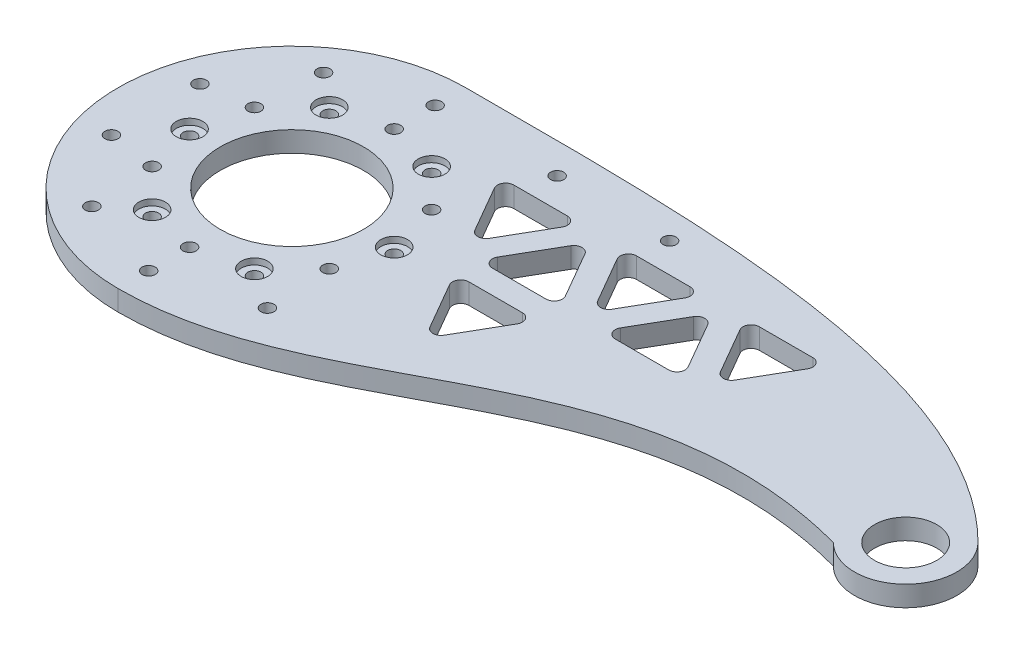
from build123d import *

# Parameters (mm, degrees)
BOSS_EXTRUDE3_OUTLINE_R   = 17.5
BOSS_EXTRUDE3_OUTLINE_R_2 = 7.6
BOSS_EXTRUDE3_DEPTH       = 5
SKETCH2_R                 = 1.6
CUT_EXTRUDE1_DEPTH        = 10
SKETCH3_R                 = 1.6
CUT_EXTRUDE2_DEPTH        = 10
SKETCH4_R                 = 1.6
CUT_EXTRUDE3_DEPTH        = 10
SKETCH5_R                 = 3.25
CUT_EXTRUDE5_DEPTH        = 1.5
CUT_EXTRUDE6_DEPTH        = 10
FILLET3_R                 = 2
FILL_PATTERN2_DEPTH       = 5
CUT_EXTRUDE7_DEPTH        = 10
FILLET4_R                 = 2
FILL_PATTERN4_DEPTH       = 5


# Read off the part's stored shape, not the designer's step: Boss-Extrude3, Fill Pattern2, Fill Pattern4
with BuildPart() as part:
    # Boss-Extrude3 outline → Boss-Extrude3 (new body)
    with BuildSketch(Plane(origin=(0, 0, 0), x_dir=(1, 0, 0), z_dir=(0, 1, 0))):
        with BuildLine():
            ThreePointArc((0, 42.5), (-42.5, 0), (0, -42.5))
            add(Edge.make_bspline(
                [(0, -42.5), (50, -42.5), (76.766110149, 8.415768242), (141.161165235, -8.838834765)],
                knots=[0, 0, 0, 0, 1, 1, 1, 1], degree=3))
            ThreePointArc((141.161165235, -8.838834765), (158.838834765, -8.838834765), (158.838834765, 8.838834765))
            add(Edge.make_bspline(
                [(0, 42.5), (53.483495706, 42.5), (123.483495706, 44.194173824), (158.838834765, 8.838834765)],
                knots=[0, 0, 0, 0, 1, 1, 1, 1], degree=3))
        make_face()
        Circle(BOSS_EXTRUDE3_OUTLINE_R, mode=Mode.SUBTRACT)
        with Locations((150, 0)):
            Circle(BOSS_EXTRUDE3_OUTLINE_R_2, mode=Mode.SUBTRACT)
    extrude(amount=BOSS_EXTRUDE3_DEPTH)

    # Sketch2 → Cut-Extrude1 (cut)
    with BuildSketch(Plane(origin=(0, 5, 0), x_dir=(1, 0, 0), z_dir=(0, 1, 0))):
        with Locations(Location((0, 35, 0), (0, 0, 270))):
            Circle(SKETCH2_R)
        with Locations(Location((0, 25, 0), (0, 0, 270))):
            Circle(SKETCH2_R)
        with Locations(Location((12.5, 21.650635095, 0), (0, 0, 270))):
            Circle(SKETCH2_R)
        with Locations(Location((21.650635095, 12.5, 0), (0, 0, 270))):
            Circle(SKETCH2_R)
        with Locations(Location((25, 0, 0), (0, 0, 270))):
            Circle(SKETCH2_R)
        with Locations(Location((21.650635095, -12.5, 0), (0, 0, 270))):
            Circle(SKETCH2_R)
        with Locations(Location((12.5, -21.650635095, 0), (0, 0, 270))):
            Circle(SKETCH2_R)
        with Locations(Location((0, -25, 0), (0, 0, 270))):
            Circle(SKETCH2_R)
        with Locations(Location((-12.5, -21.650635095, 0), (0, 0, 270))):
            Circle(SKETCH2_R)
        with Locations(Location((-21.650635095, -12.5, 0), (0, 0, 270))):
            Circle(SKETCH2_R)
        with Locations(Location((-25, 0, 0), (0, 0, 270))):
            Circle(SKETCH2_R)
        with Locations(Location((-21.650635095, 12.5, 0), (0, 0, 270))):
            Circle(SKETCH2_R)
        with Locations(Location((-12.5, 21.650635095, 0), (0, 0, 270))):
            Circle(SKETCH2_R)
        with Locations(Location((-20.57248383, 28.315594803, 0), (0, 0, 270))):
            Circle(SKETCH2_R)
        with Locations(Location((-33.28697807, 10.815594803, 0), (0, 0, 270))):
            Circle(SKETCH2_R)
        with Locations(Location((-33.28697807, -10.815594803, 0), (0, 0, 270))):
            Circle(SKETCH2_R)
        with Locations(Location((-20.57248383, -28.315594803, 0), (0, 0, 270))):
            Circle(SKETCH2_R)
        with Locations(Location((0, -35, 0), (0, 0, 270))):
            Circle(SKETCH2_R)
    extrude(amount=-CUT_EXTRUDE1_DEPTH, mode=Mode.SUBTRACT)

    # Sketch3 → Cut-Extrude2 (cut)
    with BuildSketch(Plane(origin=(0, 5, 0), x_dir=(1, 0, 0), z_dir=(0, 1, 0))):
        with Locations(Location((29.822508304, 35, 0), (0, 0, 270))):
            Circle(SKETCH3_R)
        with Locations(Location((57.312909887, 35, 0), (0, 0, 270))):
            Circle(SKETCH3_R)
    extrude(amount=-CUT_EXTRUDE2_DEPTH, mode=Mode.SUBTRACT)

    # Sketch4 → Cut-Extrude3 (cut)
    with BuildSketch(Plane(origin=(0, 5, 0), x_dir=(1, 0, 0), z_dir=(0, 1, 0))):
        with Locations(Location((22.392043347, -28.36049342, 0), (0, 0, 270))):
            Circle(SKETCH4_R)
    extrude(amount=-CUT_EXTRUDE3_DEPTH, mode=Mode.SUBTRACT)

    # Sketch5 → Cut-Extrude5 (cut)
    with BuildSketch(Plane(origin=(0, 5, 0), x_dir=(1, 0, 0), z_dir=(0, 1, 0))):
        with Locations(Location((25, 0, 0), (0, 0, 270))):
            Circle(SKETCH5_R)
        with Locations(Location((12.5, -21.650635095, 0), (0, 0, 270))):
            Circle(SKETCH5_R)
        with Locations(Location((-12.5, -21.650635095, 0), (0, 0, 270))):
            Circle(SKETCH5_R)
        with Locations(Location((-25, 0, 0), (0, 0, 270))):
            Circle(SKETCH5_R)
        with Locations(Location((-12.5, 21.650635095, 0), (0, 0, 270))):
            Circle(SKETCH5_R)
        with Locations(Location((12.5, 21.650635095, 0), (0, 0, 270))):
            Circle(SKETCH5_R)
    extrude(amount=-CUT_EXTRUDE5_DEPTH, mode=Mode.SUBTRACT)

    # Sketch6 → Cut-Extrude6 (cut)
    with BuildSketch(Plane(origin=(0, 5, 0), x_dir=(1, 0, 0), z_dir=(0, 1, 0))):
        Polygon((43, 27.773502692), (23, 27.773502692), (33, 10.452994616), align=None)
    extrude(amount=-CUT_EXTRUDE6_DEPTH, mode=Mode.SUBTRACT)

    # Fillet3
    fillet3_edges = [part.edges().sort_by_distance(p)[0] for p in [
        (43, 2.5, -27.773502692),
        (33, 2.5, -10.452994616),
        (23, 2.5, -27.773502692),
    ]]
    fillet(fillet3_edges, radius=FILLET3_R)

    # Fill Pattern2 outline → Fill Pattern2 (cut)
    with BuildSketch(Plane(origin=(0, 0, 0), x_dir=(1, 0, 0), z_dir=(0, 1, 0))):
        with BuildLine():
            ThreePointArc((41.464101615, 1.792740578), (39.732050808, 0.792740578), (39.732050808, -1.207259422))
            Line((39.732050808, -1.207259422), (46.267949192, -12.527767497))
            ThreePointArc((46.267949192, -12.527767497), (48, -13.527767497), (49.732050808, -12.527767497))
            Line((49.732050808, -12.527767497), (56.267949192, -1.207259422))
            ThreePointArc((56.267949192, -1.207259422), (56.267949192, 0.792740578), (54.535898385, 1.792740578))
            Line((54.535898385, 1.792740578), (41.464101615, 1.792740578))
        make_face()
        with BuildLine():
            ThreePointArc((101.267949192, 24.773502692), (101.267949192, 26.773502692), (99.535898385, 27.773502692))
            Line((99.535898385, 27.773502692), (86.464101615, 27.773502692))
            ThreePointArc((86.464101615, 27.773502692), (84.732050808, 26.773502692), (84.732050808, 24.773502692))
            Line((84.732050808, 24.773502692), (91.267949192, 13.452994616))
            ThreePointArc((91.267949192, 13.452994616), (93, 12.452994616), (94.732050808, 13.452994616))
            Line((94.732050808, 13.452994616), (101.267949192, 24.773502692))
        make_face()
        with BuildLine():
            ThreePointArc((71.267949192, 24.773502692), (71.267949192, 26.773502692), (69.535898385, 27.773502692))
            Line((69.535898385, 27.773502692), (56.464101615, 27.773502692))
            ThreePointArc((56.464101615, 27.773502692), (54.732050808, 26.773502692), (54.732050808, 24.773502692))
            Line((54.732050808, 24.773502692), (61.267949192, 13.452994616))
            ThreePointArc((61.267949192, 13.452994616), (63, 12.452994616), (64.732050808, 13.452994616))
            Line((64.732050808, 13.452994616), (71.267949192, 24.773502692))
        make_face()
    extrude(amount=FILL_PATTERN2_DEPTH, mode=Mode.SUBTRACT)

    # Sketch7 → Cut-Extrude7 (cut)
    with BuildSketch(Plane(origin=(0, 5, 0), x_dir=(1, 0, 0), z_dir=(0, 1, 0))):
        Polygon((58, 7.56624327), (48, 24.886751346), (38, 7.56624327), align=None)
    extrude(amount=-CUT_EXTRUDE7_DEPTH, mode=Mode.SUBTRACT)

    # Fillet4
    fillet4_edges = [part.edges().sort_by_distance(p)[0] for p in [
        (58, 2.5, -7.56624327),
        (38, 2.5, -7.56624327),
        (48, 2.5, -24.886751346),
    ]]
    fillet(fillet4_edges, radius=FILLET4_R)

    # Fill Pattern4 outline → Fill Pattern4 (cut)
    with BuildSketch(Plane(origin=(0, 0, 0), x_dir=(1, 0, 0), z_dir=(0, 1, 0))):
        with BuildLine():
            ThreePointArc((69.732050808, 10.56624327), (69.732050808, 8.56624327), (71.464101615, 7.56624327))
            Line((71.464101615, 7.56624327), (84.535898385, 7.56624327))
            ThreePointArc((84.535898385, 7.56624327), (86.267949192, 8.56624327), (86.267949192, 10.56624327))
            Line((86.267949192, 10.56624327), (79.732050808, 21.886751346))
            ThreePointArc((79.732050808, 21.886751346), (78, 22.886751346), (76.267949192, 21.886751346))
            Line((76.267949192, 21.886751346), (69.732050808, 10.56624327))
        make_face()
    extrude(amount=FILL_PATTERN4_DEPTH, mode=Mode.SUBTRACT)


solid = part.part
